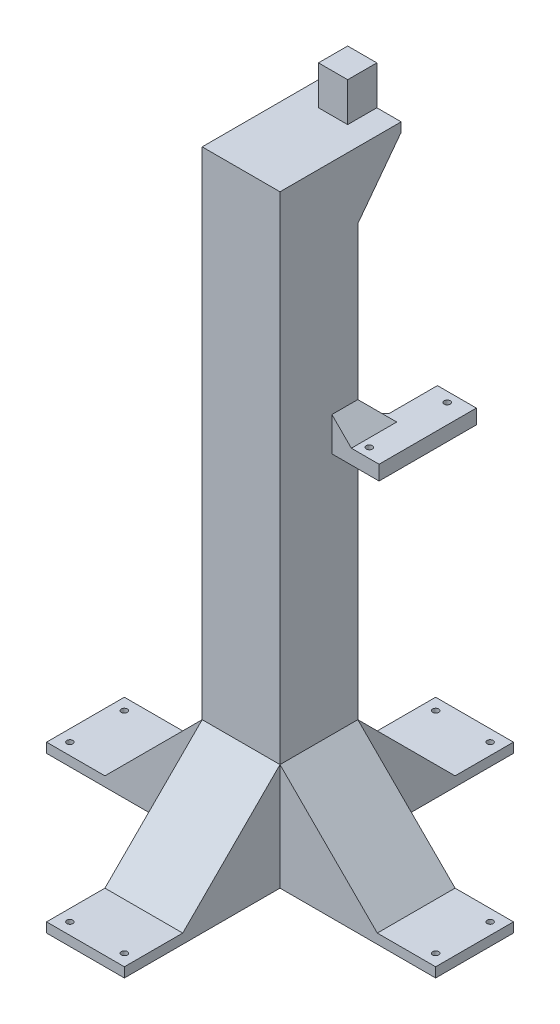
from build123d import *

# Parameters (mm, degrees)
SKETCH1_W             = 80
SKETCH1_H             = 40
SKETCH1_R             = 1.55
BOSS_EXTRUDE1_DEPTH   = 5
SKETCH1_W_2           = 40
SKETCH1_H_2           = 80
BOSS_EXTRUDE1_2_DEPTH = 5
BOSS_EXTRUDE1_3_DEPTH = 5
BOSS_EXTRUDE1_4_DEPTH = 5
SKETCH1_4_W           = 40
SKETCH1_4_H           = 40
BOSS_EXTRUDE2_DEPTH   = 310
CHAMFER1_SIZE         = 50
CHAMFER2_SIZE         = 50
BOSS_EXTRUDE3_START   = 180
SKETCH2_R             = 1.55
BOSS_EXTRUDE3_DEPTH   = 7.5
CHAMFER7_SIZE         = 10
SKETCH3_W             = 15
SKETCH3_H             = 15
BOSS_EXTRUDE4_DEPTH   = 20
SKETCH4_W             = 40
SKETCH4_H             = 22.28
BOSS_EXTRUDE5_DEPTH   = 5
CHAMFER8_SIZE         = 22
CHAMFER8_SIZE2        = 29.194986076


# Some blends are built 0.0001 mm under size
with BuildPart() as part:
    # Sketch1 → Boss-Extrude1 (new body)
    with BuildSketch(Plane(origin=(0, 0, 0), x_dir=(1, 0, 0), z_dir=(0, 1, 0))):
        with Locations((40, 20)):
            Rectangle(SKETCH1_W, SKETCH1_H)
        with Locations(Location((74, 6, 0), (0, 0, 270))):
            Circle(SKETCH1_R, mode=Mode.SUBTRACT)
        with Locations(Location((74, 34, 0), (0, 0, 270))):
            Circle(SKETCH1_R, mode=Mode.SUBTRACT)
    extrude(amount=BOSS_EXTRUDE1_DEPTH)



with BuildPart() as body_2:
    # Sketch1 → Boss-Extrude1 2 (new body)
    with BuildSketch(Plane(origin=(0, 0, 0), x_dir=(1, 0, 0), z_dir=(0, 1, 0))):
        with Locations((-20, 80)):
            Rectangle(SKETCH1_W_2, SKETCH1_H_2)
        with Locations(Location((-34, 114, 0), (0, 0, 270))):
            Circle(SKETCH1_R, mode=Mode.SUBTRACT)
        with Locations(Location((-6, 114, 0), (0, 0, 270))):
            Circle(SKETCH1_R, mode=Mode.SUBTRACT)
    extrude(amount=BOSS_EXTRUDE1_2_DEPTH)


with BuildPart() as body_3:
    # Sketch1 → Boss-Extrude1 3 (new body)
    with BuildSketch(Plane(origin=(0, 0, 0), x_dir=(1, 0, 0), z_dir=(0, 1, 0))):
        with Locations((-80, 20)):
            Rectangle(SKETCH1_W, SKETCH1_H)
        with Locations(Location((-114, 6, 0), (0, 0, 270))):
            Circle(SKETCH1_R, mode=Mode.SUBTRACT)
        with Locations(Location((-114, 34, 0), (0, 0, 270))):
            Circle(SKETCH1_R, mode=Mode.SUBTRACT)
    extrude(amount=BOSS_EXTRUDE1_3_DEPTH)


with BuildPart() as body_4:
    # Sketch1 → Boss-Extrude1 4 (new body)
    with BuildSketch(Plane(origin=(0, 0, 0), x_dir=(1, 0, 0), z_dir=(0, 1, 0))):
        with Locations((-20, -40)):
            Rectangle(SKETCH1_W_2, SKETCH1_H_2)
        with Locations(Location((-34, -74, 0), (0, 0, 270))):
            Circle(SKETCH1_R, mode=Mode.SUBTRACT)
        with Locations(Location((-6, -74, 0), (0, 0, 270))):
            Circle(SKETCH1_R, mode=Mode.SUBTRACT)
    extrude(amount=BOSS_EXTRUDE1_4_DEPTH)


with BuildPart() as part_1:
    add(part.part)

    add(body_2.part)  # Boss-Extrude2 merges body 2

    add(body_3.part)  # Boss-Extrude2 merges body 3

    add(body_4.part)  # Boss-Extrude2 merges body 4
    # Sketch1<4> → Boss-Extrude2 (add)
    with BuildSketch(Plane(origin=(0, 0, 0), x_dir=(1, 0, 0), z_dir=(0, 1, 0))):
        with Locations((-20, 20)):
            Rectangle(SKETCH1_4_W, SKETCH1_4_H)
    extrude(amount=BOSS_EXTRUDE2_DEPTH)

    # Chamfer1
    # the kernel refuses this chamfer: 50 mm, written as the material it adds along each edge
    with BuildSketch(Plane(origin=(0, 5, -40), x_dir=(1, 0, 0), z_dir=(0, 0, 1)), Plane(origin=(-40, 5, 0), x_dir=(-1, 0, 0), z_dir=(0, 0, -1))) as chamfer1_piece_1:
        Polygon((CHAMFER1_SIZE, 0), (0, CHAMFER1_SIZE), (0, 0), align=None)
    extrude(amount=40)

    # Chamfer2
    chamfer2_edges = [part_1.edges().sort_by_distance(p)[0] for p in [
        (-20, 5, -40),
        (-20, 5, 0),
    ]]
    chamfer(chamfer2_edges, length=CHAMFER2_SIZE - 0.0001)  # a hair under: the kernel refuses the full size

    # Sketch2 → Boss-Extrude3 (add)
    with BuildSketch(Plane(origin=(0, 0, 0), x_dir=(1, 0, 0), z_dir=(0, 1, 0)).offset(BOSS_EXTRUDE3_START)):
        Polygon((-64.25, 76.68), (-44.25, 76.68), (-44.25, 51.75), (-32.5, 40), (-7.5, 40), (4.25, 51.75), (4.25, 76.68), (24.25, 76.68), (24.25, 26.68), (-40, 26.68), (-64.25, 26.68), align=None)
        with Locations(Location((-54.25, 71.68, 0), (0, 0, 270))):
            Circle(SKETCH2_R, mode=Mode.SUBTRACT)
        with Locations(Location((14.25, 71.68, 0), (0, 0, 270))):
            Circle(SKETCH2_R, mode=Mode.SUBTRACT)
        with Locations(Location((-54.25, 31.68, 0), (0, 0, 270))):
            Circle(SKETCH2_R, mode=Mode.SUBTRACT)
        with Locations(Location((14.25, 31.68, 0), (0, 0, 270))):
            Circle(SKETCH2_R, mode=Mode.SUBTRACT)
    extrude(amount=BOSS_EXTRUDE3_DEPTH)

    # Chamfer7
    # the kernel refuses this chamfer: 10 mm, written as the material it adds along each edge
    with BuildSketch(Plane(origin=(-40, 187.5, -26.68), x_dir=(0, 1, 0), z_dir=(0, 0, -1))) as chamfer7_piece_1_section:
        Polygon((CHAMFER7_SIZE, 0), (0, -CHAMFER7_SIZE), (0, 0), align=None)
    chamfer7_piece_1 = extrude(amount=39.03682988, mode=Mode.PRIVATE)
    chamfer7_piece_1 = split(chamfer7_piece_1, bisect_by=Plane(origin=(-29.59, 187.5, -37.09), z_dir=(-0.7071067811865485, 0, 0.7071067811865467)), keep=Keep.TOP, mode=Mode.PRIVATE)
    chamfer7_piece_1 = split(chamfer7_piece_1, bisect_by=Plane(origin=(-40, 199.16, -38.34), z_dir=(0, -0.7071067811865476, 0.7071067811865476)), keep=Keep.TOP, mode=Mode.PRIVATE)
    add(chamfer7_piece_1)
    with BuildSketch(Plane(origin=(0, 187.5, -65.71682988), x_dir=(0, 1, 0), z_dir=(0, 0, 1))) as chamfer7_piece_2_section:
        Polygon((CHAMFER7_SIZE, 0), (0, -CHAMFER7_SIZE), (0, 0), align=None)
    chamfer7_piece_2 = extrude(amount=39.03682988, mode=Mode.PRIVATE)
    chamfer7_piece_2 = split(chamfer7_piece_2, bisect_by=Plane(origin=(9.10841494, 187.5, -56.60841494), z_dir=(0.7071067811865488, 0, 0.7071067811865462)), keep=Keep.TOP, mode=Mode.PRIVATE)
    chamfer7_piece_2 = split(chamfer7_piece_2, bisect_by=Plane(origin=(0, 179.64158506, -57.85841494), z_dir=(0, -0.7071067811865476, 0.7071067811865476)), keep=Keep.TOP, mode=Mode.PRIVATE)
    add(chamfer7_piece_2)
    with BuildSketch(Plane(origin=(-33.21682988, 187.5, -40), x_dir=(0, 1, 0), z_dir=(1, 0, 0))) as chamfer7_piece_3_section:
        Polygon((CHAMFER7_SIZE, 0), (0, -CHAMFER7_SIZE), (0, 0), align=None)
    chamfer7_piece_3 = extrude(amount=58.933659759, mode=Mode.PRIVATE)
    chamfer7_piece_3 = split(chamfer7_piece_3, bisect_by=Plane(origin=(-32.85841494, 187.5, -40.35841494), z_dir=(-0.7071067811865485, 0, 0.7071067811865467)), keep=Keep.TOP, mode=Mode.PRIVATE)
    add(chamfer7_piece_3)
    with BuildSketch(Plane(origin=(-33.21682988, 187.5, -40), x_dir=(0, 1, 0), z_dir=(1, 0, 0))) as chamfer7_piece_4_section:
        Polygon((CHAMFER7_SIZE, 0), (0, -CHAMFER7_SIZE), (0, 0), align=None)
    chamfer7_piece_4 = extrude(amount=58.933659759, mode=Mode.PRIVATE)
    chamfer7_piece_4 = split(chamfer7_piece_4, bisect_by=Plane(origin=(-20.35841494, 187.5, -27.14158506), z_dir=(0.7071067811865488, 0, 0.7071067811865462)), keep=Keep.TOP, mode=Mode.PRIVATE)
    chamfer7_piece_4 = split(chamfer7_piece_4, bisect_by=Plane(origin=(-11.60841494, 209.10841494, -40), z_dir=(-0.7071067811865476, -0.7071067811865476, 0)), keep=Keep.TOP, mode=Mode.PRIVATE)
    add(chamfer7_piece_4)
    with BuildSketch(Plane(origin=(-65.71682988, 187.5, -40), x_dir=(0, 1, 0), z_dir=(1, 0, 0))) as chamfer7_piece_5_section:
        Polygon((CHAMFER7_SIZE, 0), (0, -CHAMFER7_SIZE), (0, 0), align=None)
    chamfer7_piece_5 = extrude(amount=58.933659759, mode=Mode.PRIVATE)
    chamfer7_piece_5 = split(chamfer7_piece_5, bisect_by=Plane(origin=(-49.10841494, 187.5, -56.60841494), z_dir=(-0.7071067811865485, 0, 0.7071067811865467)), keep=Keep.TOP, mode=Mode.PRIVATE)
    chamfer7_piece_5 = split(chamfer7_piece_5, bisect_by=Plane(origin=(-57.85841494, 179.64158506, -40), z_dir=(0.7071067811865476, -0.7071067811865476, 0)), keep=Keep.TOP, mode=Mode.PRIVATE)
    add(chamfer7_piece_5)
    with BuildSketch(Plane(origin=(-65.71682988, 187.5, -40), x_dir=(0, 1, 0), z_dir=(1, 0, 0))) as chamfer7_piece_6_section:
        Polygon((CHAMFER7_SIZE, 0), (0, -CHAMFER7_SIZE), (0, 0), align=None)
    chamfer7_piece_6 = extrude(amount=58.933659759, mode=Mode.PRIVATE)
    chamfer7_piece_6 = split(chamfer7_piece_6, bisect_by=Plane(origin=(-36.60841494, 187.5, -10.89158506), z_dir=(0.7071067811865488, 0, 0.7071067811865462)), keep=Keep.TOP, mode=Mode.PRIVATE)
    add(chamfer7_piece_6)



with BuildPart() as body_2_2:
    # Sketch3 → Boss-Extrude4 (new body)
    with BuildSketch(Plane(origin=(0, 310, 0), x_dir=(1, 0, 0), z_dir=(0, 1, 0))):
        with Locations((-20, 54.78)):
            Rectangle(SKETCH3_W, SKETCH3_H)
    extrude(amount=BOSS_EXTRUDE4_DEPTH)


with BuildPart() as part_2:
    add(part_1.part)

    add(body_2_2.part)  # Boss-Extrude5 merges body 2 2
    # Sketch4 → Boss-Extrude5 (add)
    with BuildSketch(Plane(origin=(0, 310, 0), x_dir=(1, 0, 0), z_dir=(0, 1, 0))):
        with Locations((-20, 51.14)):
            Rectangle(SKETCH4_W, SKETCH4_H)
    extrude(amount=-BOSS_EXTRUDE5_DEPTH)

    # Chamfer8
    chamfer8_edges = [part_2.edges().sort_by_distance(p)[0] for p in [
        (-20, 305, -40),
    ]]
    chamfer8_side = [part_2.faces().sort_by_distance(p)[0] for p in [
        (-20, 305, -51.14),
    ]]
    chamfer(chamfer8_edges, length=CHAMFER8_SIZE, length2=CHAMFER8_SIZE2, reference=chamfer8_side[0])


solid = part_2.part
